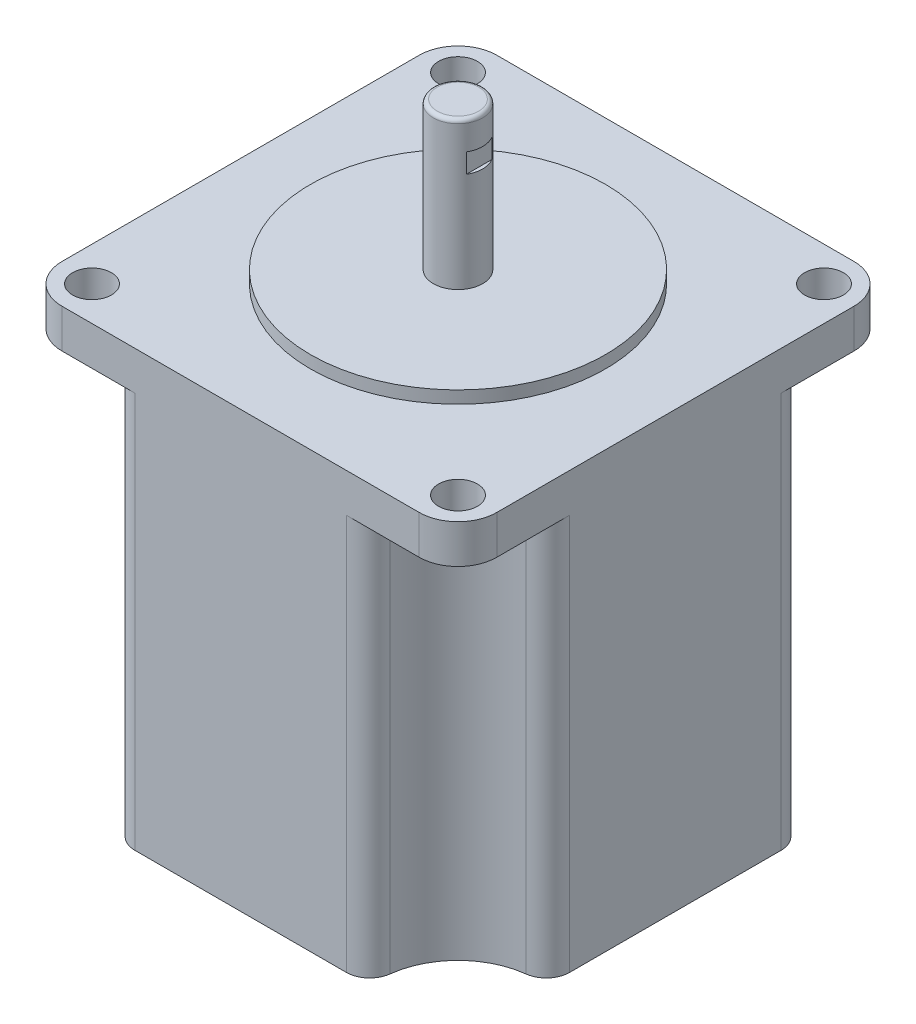
from build123d import *

# Parameters (mm, degrees)
EXTRUDE1_DEPTH      = 56
SKETCH2_R           = 2.5
EXTRUDE2_DEPTH      = 69.585712798
SKETCH4_R           = 10
EXTRUDE3_DEPTH      = 51
FILLET1_R           = 3
SKETCH5_R           = 19
EXTRUDE4_DEPTH      = 1.6
SKETCH6_R           = 3.175
EXTRUDE5_DEPTH      = 20.6
FILLET2_R           = 0.5
SKETCH_1_W          = 0.754278007
SKETCH_1_H          = 3.431599036
CUT_EXTRUDE_1_DEPTH = 2.5


with BuildPart() as part:
    # Sketch1 → Extrude1 (new body)
    with BuildSketch(Plane(origin=(0, 0, 0), x_dir=(1, 0, 0), z_dir=(0, 1, 0))):
        with BuildLine():
            Line((-23, 28), (23, 28))
            ThreePointArc((23, 28), (26.535533906, 26.535533906), (28, 23))
            Line((28, 23), (28, -23))
            ThreePointArc((28, -23), (26.535533906, -26.535533906), (23, -28))
            Line((23, -28), (-23, -28))
            ThreePointArc((-23, -28), (-26.535533906, -26.535533906), (-28, -23))
            Line((-28, -23), (-28, 23))
            ThreePointArc((-28, 23), (-26.535533906, 26.535533906), (-23, 28))
        make_face()
    extrude(amount=EXTRUDE1_DEPTH)

    # Sketch2 → Extrude2 (cut, through all)
    with BuildSketch(Plane.XZ):
        with Locations((23.57, 23.57)):
            Circle(SKETCH2_R)
        with Locations((23.57, -23.57)):
            Circle(SKETCH2_R)
        with Locations((-23.57, -23.57)):
            Circle(SKETCH2_R)
        with Locations((-23.57, 23.57)):
            Circle(SKETCH2_R)
    extrude(amount=-EXTRUDE2_DEPTH, mode=Mode.SUBTRACT)

    # Sketch4 → Extrude3 (cut)
    with BuildSketch(Plane.XZ):
        with Locations((-26.535533906, 26.535533906)):
            Circle(SKETCH4_R)
        with Locations((26.535533906, 26.535533906)):
            Circle(SKETCH4_R)
        with Locations((26.535533906, -26.535533906)):
            Circle(SKETCH4_R)
        with Locations((-26.535533906, -26.535533906)):
            Circle(SKETCH4_R)
    extrude(amount=-EXTRUDE3_DEPTH, mode=Mode.SUBTRACT)

    # Fillet1
    fillet1_edges = [part.edges().sort_by_distance(p)[0] for p in [
        (-16.643348149, 25.5, -28),
        (-28, 25.5, -16.643348149),
        (16.643348149, 25.5, -28),
        (28, 25.5, -16.643348149),
        (28, 25.5, 16.643348149),
        (16.643348149, 25.5, 28),
        (-16.643348149, 25.5, 28),
        (-28, 25.5, 16.643348149),
    ]]
    fillet(fillet1_edges, radius=FILLET1_R)

    # Sketch5 → Extrude4 (add)
    with BuildSketch(Plane(origin=(0, 56, 0), x_dir=(1, 0, 0), z_dir=(0, 1, 0))):
        Circle(SKETCH5_R)
    extrude(amount=EXTRUDE4_DEPTH)

    # Sketch6 → Extrude5 (add)
    with BuildSketch(Plane(origin=(0, 56, 0), x_dir=(1, 0, 0), z_dir=(0, 1, 0))):
        Circle(SKETCH6_R)
    extrude(amount=EXTRUDE5_DEPTH)

    # Fillet2
    fillet2_edges = [part.edges().sort_by_distance(p)[0] for p in [
        (-3.175, 76.6, 0),
    ]]
    fillet(fillet2_edges, radius=FILLET2_R)

    # Эскиз1 → Вытянуть1 (cut)
    with BuildSketch(Plane(origin=(0, 70.4, 0), x_dir=(-1, 0, 0), z_dir=(0, 1, 0))):
        with Locations((3.096320075, 0.076690216)):
            Rectangle(SKETCH_1_W, SKETCH_1_H)
        with Locations((-3.096320075, 0.076690216)):
            Rectangle(SKETCH_1_W, SKETCH_1_H)
    extrude(amount=CUT_EXTRUDE_1_DEPTH, mode=Mode.SUBTRACT)


solid = part.part
